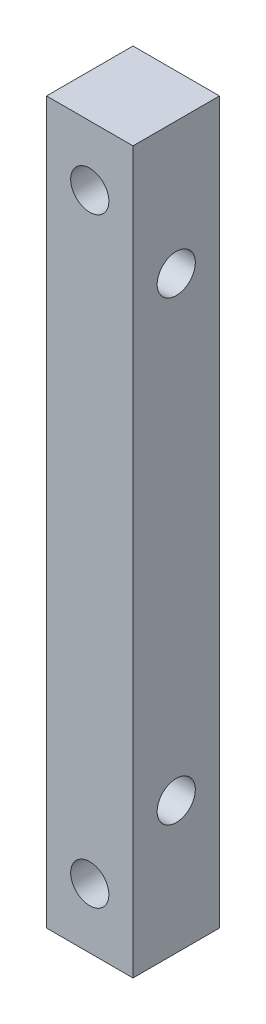
from build123d import *

# Parameters (mm, degrees)
SKETCH1_W                  = 9.144
SKETCH1_H                  = 9.144
BOSS_EXTRUDE1_DEPTH        = 76.2
TAP_DRILL_FOR_10_32_TAP1_D = 4.0386
TAP_DRILL_FOR_10_32_TAP2_D = 4.0386


with BuildPart() as part:
    # Sketch1 → Boss-Extrude1 (new body)
    with BuildSketch(Plane(origin=(0, 0, 0), x_dir=(1, 0, 0), z_dir=(0, 1, 0))):
        Rectangle(SKETCH1_W, SKETCH1_H)
    extrude(amount=BOSS_EXTRUDE1_DEPTH)

    # Tap Drill for #10-32 Tap1 (through all)
    with Locations(Plane.XY.offset(4.572)):
        with Locations((0, 69.85), (0, 6.35)):
            Hole(TAP_DRILL_FOR_10_32_TAP1_D / 2)

    # Tap Drill for #10-32 Tap2 (through all)
    with Locations(Plane(origin=(4.572, 0, 0), x_dir=(0, 0, -1), z_dir=(1, 0, 0))):
        with Locations((0, 62.23), (0, 13.97)):
            Hole(TAP_DRILL_FOR_10_32_TAP2_D / 2)


solid = part.part
